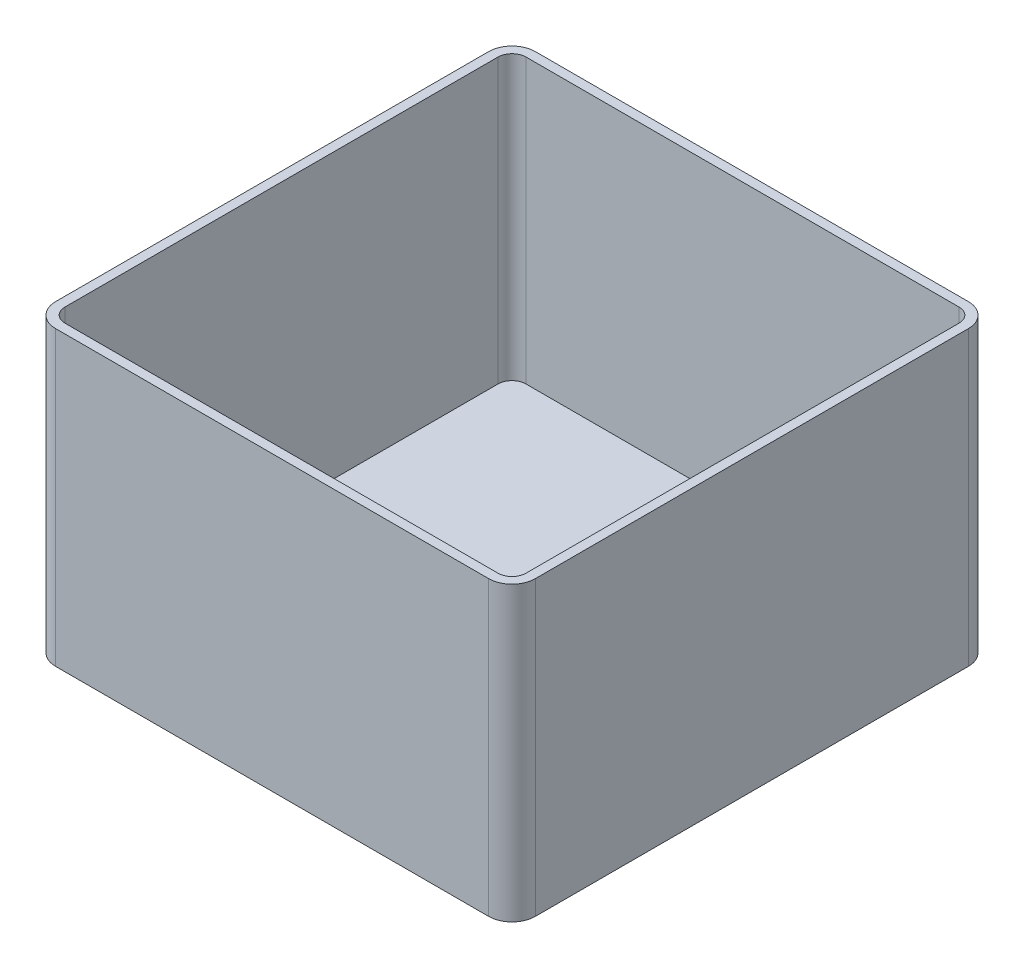
from build123d import *

# Parameters (mm, degrees)
SKETCH1_W           = 52.07
SKETCH1_H           = 52.07
BOSS_EXTRUDE1_DEPTH = 31.75
FILLET1_R           = 2.54
SHELL2_T            = -1.016


with BuildPart() as part:
    # Sketch1 → Boss-Extrude1 (new body)
    with BuildSketch(Plane(origin=(0, 0, 0), x_dir=(1, 0, 0), z_dir=(0, 1, 0))):
        Rectangle(SKETCH1_W, SKETCH1_H)
    extrude(amount=BOSS_EXTRUDE1_DEPTH)

    # Fillet1
    fillet1_edges = [part.edges().sort_by_distance(p)[0] for p in [
        (-26.035, 15.875, -26.035),
        (-26.035, 15.875, 26.035),
        (26.035, 15.875, 26.035),
        (26.035, 15.875, -26.035),
    ]]
    fillet(fillet1_edges, radius=FILLET1_R)

    # Shell2
    shell2_openings = [part.faces().sort_by_distance(p)[0] for p in [
        (0, 31.75, 0),
    ]]
    offset(amount=SHELL2_T, openings=shell2_openings, kind=Kind.INTERSECTION)


solid = part.part
